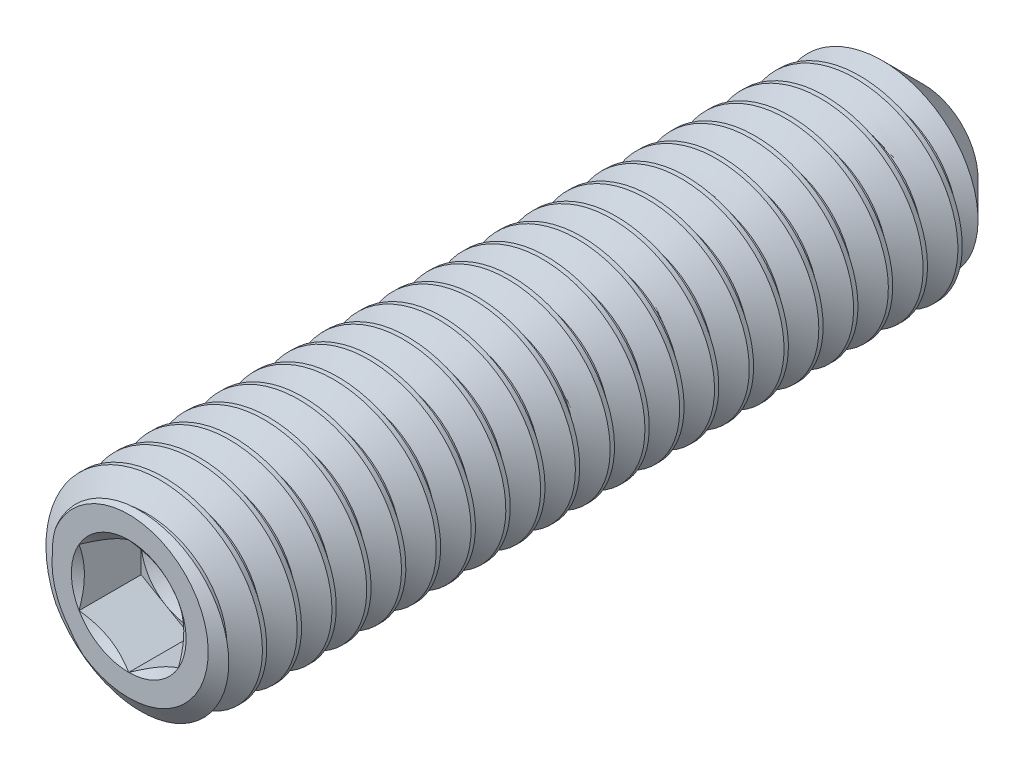
from build123d import *

# Parameters (mm, degrees)
CUT_SWEEP_PITCH   = 0.7
HEX_EXTRUDE_DEPTH = 1.25


with BuildPart() as part:
    # Body Sketch → Body Revolve (revolve)
    with BuildSketch(Plane(origin=(0, 0, 0), x_dir=(0, 0, -1), z_dir=(1, 0, 0))):
        Polygon((-7.670749467, 0), (-7.670749467, 1.6), (-7.390666452, 2), (7.425180345, 2), (8.329250533, 1.095929813), (7.670749467, 0), align=None)
    revolve(axis=Axis((0, 0, -7.670749467), (0, 0, 1)))

    # Cut Sweep: the profile of Cut Sweep Sketch profile screwed along a right-hand helix of 23.857143 turns, 6 arcs to a turn; built about Z, then put on its axis
    cut_sweep_z = Axis((0, 0, 0), (0, 0, 1))
    cut_sweep_corners = [(2.0003, 0, 0.000173205), (2.0003, 0, -0.612673205), (1.545336663, 0, -0.35), (1.545336663, 0, -0.2625)]
    with BuildLine(mode=Mode.PRIVATE) as cut_sweep_profile:
        Line(cut_sweep_corners[0], cut_sweep_corners[1])
        Line(cut_sweep_corners[1], cut_sweep_corners[2])
        Line(cut_sweep_corners[2], cut_sweep_corners[3])
        Line(cut_sweep_corners[3], cut_sweep_corners[0])
    cut_sweep_cap = Face(cut_sweep_profile.wire())
    cut_sweep_turn_angles = [0, 30, 60, 90, 120, 150, 180, 210, 240, 270, 300, 330, 360]
    cut_sweep_turn_weights = [1, 0.8660254037844387, 1, 0.8660254037844387, 1, 0.8660254037844387, 1, 0.8660254037844387, 1, 0.8660254037844387, 1, 0.8660254037844387, 1]
    cut_sweep_turn_rails = [Edge.make_bspline([Vector(p[0], p[1], 0).rotate(cut_sweep_z, cut_sweep_turn_angles[k]) / cut_sweep_turn_weights[k] + Vector(0, 0, p[2] + CUT_SWEEP_PITCH * cut_sweep_turn_angles[k] / 360) for k in range(13)], [0, 0, 0, 1, 1, 2, 2, 3, 3, 4, 4, 5, 5, 6, 6, 6], 2, cut_sweep_turn_weights) for p in cut_sweep_corners]
    cut_sweep_turn_sides = [Face.make_surface_from_curves(cut_sweep_turn_rails[p[0]], cut_sweep_turn_rails[p[1]]) for p in [(0, 1), (1, 2), (2, 3), (3, 0)]]
    cut_sweep_last_angles = [8280, 8310, 8340, 8370, 8400, 8430, 8460, 8490, 8520, 8550, 8580, 8584.285714286, 8588.571428571]
    cut_sweep_last_weights = [1, 0.8660254037844387, 1, 0.8660254037844387, 1, 0.8660254037844387, 1, 0.8660254037844387, 1, 0.8660254037844387, 1, 0.997203797181252, 1]
    cut_sweep_last_rails = [Edge.make_bspline([Vector(p[0], p[1], 0).rotate(cut_sweep_z, cut_sweep_last_angles[k]) / cut_sweep_last_weights[k] + Vector(0, 0, p[2] + CUT_SWEEP_PITCH * cut_sweep_last_angles[k] / 360) for k in range(13)], [0, 0, 0, 1, 1, 2, 2, 3, 3, 4, 4, 5, 5, 6, 6, 6], 2, cut_sweep_last_weights) for p in cut_sweep_corners]
    cut_sweep_last_sides = [Face.make_surface_from_curves(cut_sweep_last_rails[p[0]], cut_sweep_last_rails[p[1]]) for p in [(0, 1), (1, 2), (2, 3), (3, 0)]]
    cut_sweep = Plane(origin=(0, 0, -8.329250533), x_dir=(0, 1, 0), z_dir=(0, 0, 1)) * Solid(Shell([*[p.moved(Location((0, 0, CUT_SWEEP_PITCH * i))) for i in range(23) for p in cut_sweep_turn_sides], *cut_sweep_last_sides, cut_sweep_cap, cut_sweep_cap.rotate(cut_sweep_z, 8588.571428571).moved(Location((0, 0, CUT_SWEEP_PITCH * 8588.571428571 / 360)))]))
    add(cut_sweep, mode=Mode.SUBTRACT)

    # Hex Sketch → Hex Extrude (cut)
    with BuildSketch(Plane.XY.offset(7.670749467)):
        Polygon((0, 1.154700538), (-1, 0.577350269), (-1, -0.577350269), (0, -1.154700538), (1, -0.577350269), (1, 0.577350269), align=None)
    extrude(amount=-HEX_EXTRUDE_DEPTH, mode=Mode.SUBTRACT)

    # Hex Entry Extrude cone 1 section (through the dimple's axis) → Hex Entry Extrude (revolve, cut)
    with BuildSketch(Plane(origin=(0, 0, 7.670749467), x_dir=(0, -1, 0), z_dir=(1, 0, 0))):
        Polygon((0, 0), (1.154700538, 0), (0, 0.808530021), align=None)
    revolve(axis=Axis((0, 0, 7.670749467), (0, 0, -1)), mode=Mode.SUBTRACT)

    # Hex Bottom Extrude cone 1 section (through the dimple's axis) → Hex Bottom Extrude (revolve, cut)
    with BuildSketch(Plane(origin=(0, 0, 6.420749467), x_dir=(0, -1, 0), z_dir=(1, 0, 0))):
        Polygon((0, 0), (1, 0), (0, 0.577350269), align=None)
    revolve(axis=Axis((0, 0, 6.420749467), (0, 0, -1)), mode=Mode.SUBTRACT)


solid = part.part
